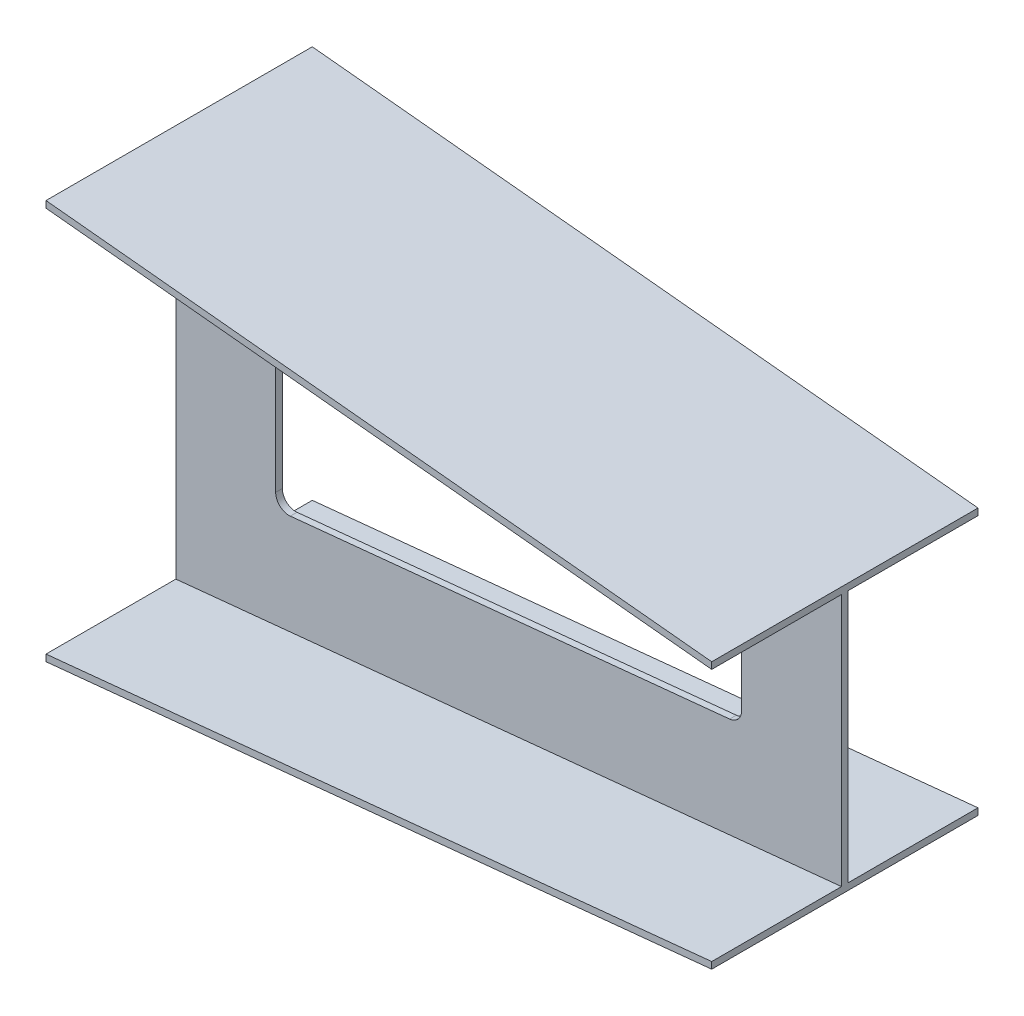
from build123d import *

# Parameters (mm, degrees)
CUT_EXTRUDE1_DEPTH = 10


with BuildPart() as part:
    # Sketch1 → Loft4 section 0
    with BuildSketch(Plane(origin=(0, 0, 0), x_dir=(0, 0, -1), z_dir=(1, 0, 0))):
        with BuildLine():
            Line((-205, 300), (195, 300))
            Line((195, 300), (195, 290))
            Line((195, 290), (0, 290))
            Line((0, 290), (0, -290))
            Line((0, -290), (195, -290))
            Line((195, -290), (195, -300))
            Line((195, -300), (-205, -300))
            Line((-205, -300), (-205, -290))
            Line((-205, -290), (-10, -290))
            Line((-10, -290), (-10, 290))
            Line((-10, 290), (-205, 290))
            Line((-205, 290), (-205, 300))
        make_face()
    # Sketch4 → Loft4 section 1
    with BuildSketch(Plane(origin=(1000, 0, -1000), x_dir=(0, 0, 1), z_dir=(-1, 0, 0))):
        with BuildLine():
            Line((805, 200), (1205, 200))
            Line((1205, 200), (1205, 190))
            Line((1205, 190), (1010, 190))
            Line((1010, 190), (1010, -190))
            Line((1010, -190), (1205, -190))
            Line((1205, -190), (1205, -200))
            Line((1205, -200), (805, -200))
            Line((805, -200), (805, -190))
            Line((805, -190), (1000, -190))
            Line((1000, -190), (1000, 190))
            Line((1000, 190), (805, 190))
            Line((805, 190), (805, 200))
        make_face()
    loft()

    # Sketch6 → Cut-Extrude1 (cut)
    with BuildSketch(Plane.XY.offset(10)):
        with BuildLine():
            Line((171.99007438, -122.052858245), (831.99007438, -56.052858245))
            ThreePointArc((831.99007438, -56.052858245), (844.829050671, -49.572220856), (850, -36.152114441))
            Line((850, -36.152114441), (850, 36.152114441))
            ThreePointArc((850, 36.152114441), (844.829050671, 49.572220856), (831.99007438, 56.052858245))
            Line((831.99007438, 56.052858245), (171.99007438, 122.052858245))
            ThreePointArc((171.99007438, 122.052858245), (156.579893585, 116.981165112), (150, 102.152114441))
            Line((150, 102.152114441), (150, -102.152114441))
            ThreePointArc((150, -102.152114441), (156.579893585, -116.981165112), (171.99007438, -122.052858245))
        make_face()
    extrude(amount=-CUT_EXTRUDE1_DEPTH, mode=Mode.SUBTRACT)


solid = part.part
